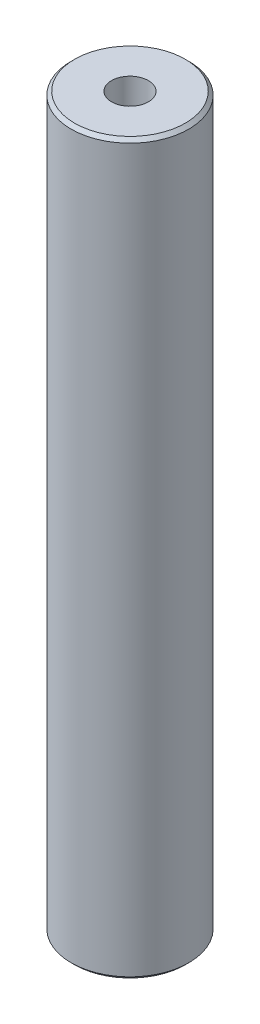
from build123d import *

# Parameters (mm, degrees)
SKETCH1_R           = 35
BOSS_EXTRUDE1_DEPTH = 433.654676848
SKETCH2_R           = 10.971733386
CUT_EXTRUDE1_DEPTH  = 437.470364116
CHAMFER1_SIZE       = 2.052035933


with BuildPart() as part:
    # Sketch1 → Boss-Extrude1 (new body)
    with BuildSketch(Plane(origin=(0, 0, 0), x_dir=(1, 0, 0), z_dir=(0, 1, 0))):
        Circle(SKETCH1_R)
    extrude(amount=BOSS_EXTRUDE1_DEPTH)

    # Sketch2 → Cut-Extrude1 (cut, through all)
    with BuildSketch(Plane(origin=(0, 0, 0), x_dir=(1, 0, 0), z_dir=(0, 1, 0))):
        Circle(SKETCH2_R)
    extrude(amount=CUT_EXTRUDE1_DEPTH, mode=Mode.SUBTRACT)

    # Chamfer1
    chamfer1_edges = [part.edges().sort_by_distance(p)[0] for p in [
        (-35, 433.654676848, 0),
        (-35, 0, 0),
    ]]
    chamfer(chamfer1_edges, length=CHAMFER1_SIZE)


solid = part.part
